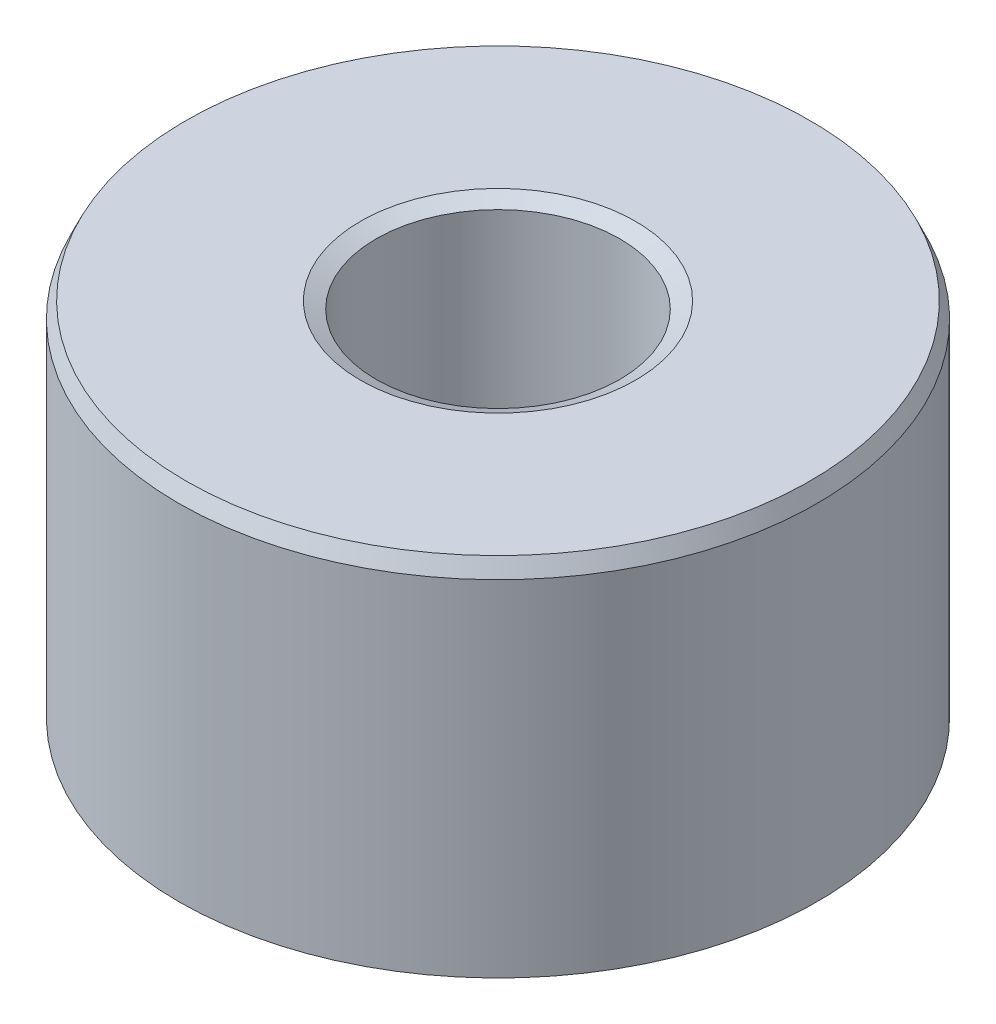
from build123d import *
from OCP.BRepFilletAPI import BRepFilletAPI_MakeChamfer

# Parameters (mm, degrees)
SKETCH1_R           = 10
BOSS_EXTRUDE1_DEPTH = 11.521673741
SKETCH2_R           = 3.815610321
CUT_EXTRUDE1_DEPTH  = 19.241407999
CHAMFER1_SIZE       = 0.494087119
CHAMFER1_SIZE2      = 0.226137422


with BuildPart() as part:
    # Sketch1 → Boss-Extrude1 (new body)
    with BuildSketch(Plane(origin=(0, 0, 0), x_dir=(1, 0, 0), z_dir=(0, 1, 0))):
        Circle(SKETCH1_R)
    extrude(amount=BOSS_EXTRUDE1_DEPTH)

    # Sketch2 → Cut-Extrude1 (cut, through all)
    with BuildSketch(Plane(origin=(0, 0, 0), x_dir=(1, 0, 0), z_dir=(0, 1, 0))):
        Circle(SKETCH2_R)
    extrude(amount=CUT_EXTRUDE1_DEPTH, mode=Mode.SUBTRACT)

    # Chamfer1: one chamfer whose edges measure the first distance from different faces: ONE call of the kernel's chamfer builder (chamfer() names one face for all edges)
    chamfer1_edges_1 = [part.edges().sort_by_distance(p)[0] for p in [
        (-3.815610321, 11.521673741, 0),
    ]]
    chamfer1_side_1 = [part.faces().sort_by_distance(p)[0] for p in [
        (-9.717157288, 11.521673741, 0),
    ]]
    chamfer1_edges_2 = [part.edges().sort_by_distance(p)[0] for p in [
        (-3.815610321, 0, 0),
    ]]
    chamfer1_side_2 = [part.faces().sort_by_distance(p)[0] for p in [
        (-3.815610321, 5.76083687, 0),
    ]]
    chamfer1_edges_3 = [part.edges().sort_by_distance(p)[0] for p in [
        (-10, 0, 0),
    ]]
    chamfer1_side_3 = [part.faces().sort_by_distance(p)[0] for p in [
        (-9.717157288, 0, 0),
    ]]
    chamfer1_edges_4 = [part.edges().sort_by_distance(p)[0] for p in [
        (-10, 11.521673741, 0),
    ]]
    chamfer1_side_4 = [part.faces().sort_by_distance(p)[0] for p in [
        (-10, 5.76083687, 0),
    ]]
    chamfer1 = BRepFilletAPI_MakeChamfer(part.part.solid().wrapped)
    for e in chamfer1_edges_1:
        chamfer1.Add(CHAMFER1_SIZE, CHAMFER1_SIZE2, e.wrapped, chamfer1_side_1[0].wrapped)  # the first distance lies on this face
    for e in chamfer1_edges_2:
        chamfer1.Add(CHAMFER1_SIZE, CHAMFER1_SIZE2, e.wrapped, chamfer1_side_2[0].wrapped)  # the first distance lies on this face
    for e in chamfer1_edges_3:
        chamfer1.Add(CHAMFER1_SIZE, CHAMFER1_SIZE2, e.wrapped, chamfer1_side_3[0].wrapped)  # the first distance lies on this face
    for e in chamfer1_edges_4:
        chamfer1.Add(CHAMFER1_SIZE, CHAMFER1_SIZE2, e.wrapped, chamfer1_side_4[0].wrapped)  # the first distance lies on this face
    add(Compound.cast(chamfer1.Shape()), mode=Mode.REPLACE)


solid = part.part
